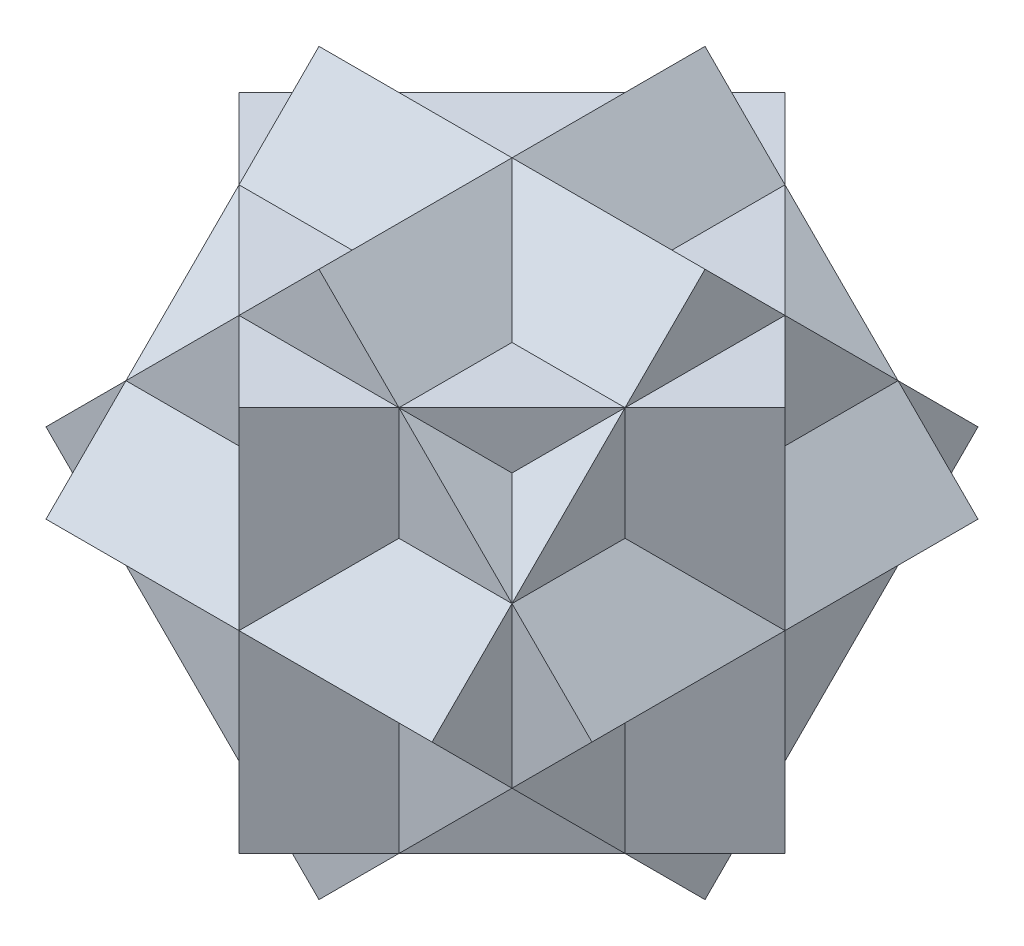
from build123d import *

# Parameters (mm, degrees)
BOSS_EXTRUDE1_DEPTH = 108.204878078
BOSS_EXTRUDE2_DEPTH = 108.204878078
BOSS_EXTRUDE3_DEPTH = 108.204878078


with BuildPart() as part:
    # Sketch3 → Boss-Extrude1 (new, symmetric)
    with BuildSketch(Plane.XY):
        Polygon((-153.024806093, 0), (0, 153.024806093), (153.024806093, 0), (0, -153.024806093), align=None)
    extrude(amount=BOSS_EXTRUDE1_DEPTH, both=True)

    # Sketch4 → Boss-Extrude2 (add, symmetric)
    with BuildSketch(Plane(origin=(0, 0, 0), x_dir=(1, 0, 0), z_dir=(0, 1, 0))):
        Polygon((-153.024806093, 0), (0, 153.024806093), (153.024806093, 0), (0, -153.024806093), align=None)
    extrude(amount=BOSS_EXTRUDE2_DEPTH, both=True)

    # Sketch5 → Boss-Extrude3 (add, symmetric)
    with BuildSketch(Plane(origin=(0, 0, 0), x_dir=(0, 0, -1), z_dir=(1, 0, 0))):
        Polygon((-153.024806093, 0), (0, 153.024806093), (153.024806093, 0), (0, -153.024806093), align=None)
    extrude(amount=BOSS_EXTRUDE3_DEPTH, both=True)


solid = part.part
